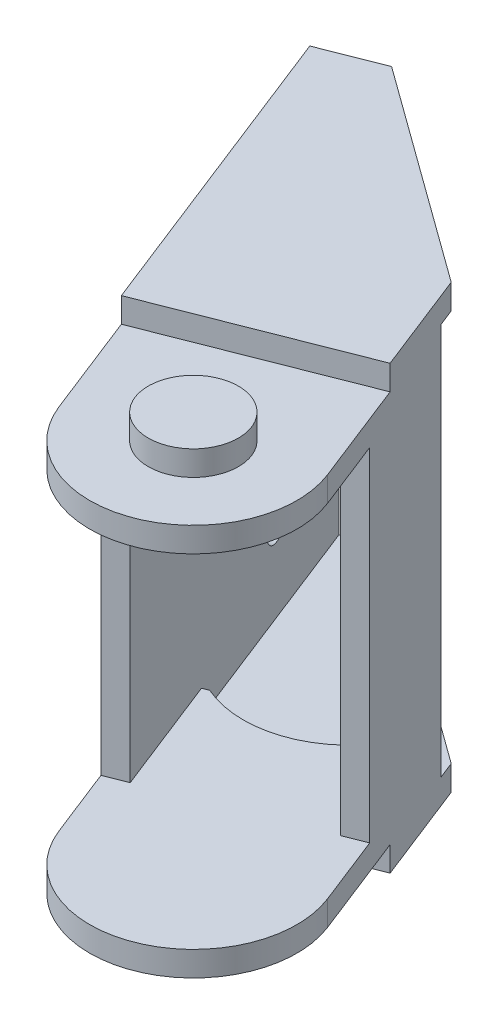
from build123d import *

# Parameters (mm, degrees)
SALIENTE_EXTRUIR1_START   = -2.75
SALIENTE_EXTRUIR1_DEPTH   = 5.5
SALIENTE_EXTRUIR1_2_DEPTH = 2.75
SALIENTE_EXTRUIR2_DEPTH   = 38
SALIENTE_EXTRUIR3_START   = 2.75
SALIENTE_EXTRUIR3_DEPTH   = 2.75
CROQUIS4_W                = 23
CROQUIS4_H                = 43.5
CORTAR_EXTRUIR1_DEPTH     = 8.25
CORTAR_EXTRUIR2_DEPTH     = 2.75
CROQUIS6_W                = 38
CROQUIS6_H                = 22.249999999
CORTAR_EXTRUIR3_DEPTH     = 16.59246817
CROQUIS7_W                = 3.203765914
CROQUIS7_H                = 38
CORTAR_EXTRUIR4_DEPTH     = 8.25
CROQUIS8_W                = 3.203765916
CROQUIS8_H                = 38
CORTAR_EXTRUIR5_DEPTH     = 8.25
CROQUIS9_W                = 14
CROQUIS9_H                = 38
CORTAR_EXTRUIR6_DEPTH     = 0.703765915
CROQUIS10_W               = 14
CROQUIS10_H               = 38
CORTAR_EXTRUIR7_DEPTH     = 0.703765915
SALIENTE_EXTRUIR4_START   = 2.75
SALIENTE_EXTRUIR4_DEPTH   = 2.75
CORTAR_EXTRUIR8_DEPTH     = 2.75
CROQUIS13_W               = 12.249999999
CROQUIS13_H               = 2.75
CORTAR_EXTRUIR9_DEPTH     = 74.034358614
CROQUIS14_W               = 12.249999999
CROQUIS14_H               = 2.75
CORTAR_EXTRUIR10_DEPTH    = 74.034358614
CROQUIS15_W               = 5
CROQUIS15_H               = 2.75
CROQUIS16_W               = 5
CROQUIS16_H               = 2.75
TALADRO1_D                = 10.15
TALADRO1_DEPTH            = 2.75
TALADRO2_D                = 10.15
CORTAR_EXTRUIR11_DEPTH    = 2.75
CORTAR_EXTRUIR12_START    = -2.75
CORTAR_EXTRUIR12_DEPTH    = 2.75
CORTAR_EXTRUIR13_REACH    = 202.135
SALIENTE_EXTRUIR5_DEPTH   = 2.75
SALIENTE_EXTRUIR6_DEPTH   = 2.75
CROQUIS26_W               = 27
CROQUIS26_H               = 43.5
SALIENTE_EXTRUIR7_DEPTH   = 2.5
CROQUIS27_R               = 2
CORTAR_EXTRUIR14_DEPTH    = 2.5


with BuildPart() as part:
    # Saliente-Extruir1: read off the stored shape, not the designer's step
    # Saliente-Extruir1 outline → Saliente-Extruir1 (new body)
    with BuildSketch(Plane(origin=(0, 40.75, 0), x_dir=(-1, 0, 0), z_dir=(0, 1, 0)).offset(SALIENTE_EXTRUIR1_START)):
        with BuildLine():
            Line((161.177139208, 19.345694485), (182.584423689, 27.755698719))
            Line((182.584423689, 27.755698719), (171.432026769, 56.143619441))
            ThreePointArc((171.432026769, 56.143619441), (156.523382412, 62.642259564), (150.024742289, 47.733615207))
            Line((150.024742289, 47.733615207), (161.177139208, 19.345694485))
        make_face()
    extrude(amount=SALIENTE_EXTRUIR1_DEPTH)

    # Saliente-Extruir1 2 outline → Saliente-Extruir1 2 (add)
    with BuildSketch(Plane(origin=(0, 40.75, 0), x_dir=(-1, 0, 0), z_dir=(0, 1, 0))):
        with BuildLine():
            ThreePointArc((161.177139208, 19.345694485), (176.085783565, 12.847054362), (182.584423687, 27.755698719))
            Line((182.584423687, 27.755698719), (161.177139208, 19.345694485))
        make_face()
    extrude(amount=SALIENTE_EXTRUIR1_2_DEPTH)

    # Croquis2 → Saliente-Extruir2 (add)
    with BuildSketch(Plane.XZ.offset(-38)):
        Polygon((-171.432026768, 56.143619442), (-150.024742288, 47.733615205), (-161.177139209, 19.345694483), (-182.584423689, 27.755698719), align=None)
    extrude(amount=SALIENTE_EXTRUIR2_DEPTH)

    # Croquis3 → Saliente-Extruir3 (add)
    with BuildSketch(Plane.XZ.offset(SALIENTE_EXTRUIR3_START)):
        with BuildLine():
            Line((-182.584423688, 27.755698719), (-171.432026768, 56.143619441))
            ThreePointArc((-171.432026768, 56.143619441), (-156.523382412, 62.642259564), (-150.024742289, 47.733615207))
            Line((-150.024742289, 47.733615207), (-161.177139208, 19.345694485))
            Line((-161.177139208, 19.345694485), (-182.584423688, 27.755698719))
        make_face()
    extrude(amount=-SALIENTE_EXTRUIR3_DEPTH)

    # Croquis4 → Cortar-Extruir1 (cut)
    with BuildSketch(Plane(origin=(-14.965700114, 0, -38.094511116), x_dir=(-0.9307514991056489, 0, 0.3656523580022251), z_dir=(-0.3656523580022251, 0, -0.9307514991056489))):
        with Locations((168.589662745, 19)):
            Rectangle(CROQUIS4_W, CROQUIS4_H)
    extrude(amount=-CORTAR_EXTRUIR1_DEPTH, mode=Mode.SUBTRACT)

    # Croquis5 → Cortar-Extruir2 (cut)
    with BuildSketch(Plane(origin=(0, 40.75, 0), x_dir=(1, 0, 0), z_dir=(0, 1, 0))):
        with BuildLine():
            Line((-161.142417183, -28.195858914), (-176.585881806, -34.262934025))
            ThreePointArc((-176.585881806, -34.262934025), (-167.602648859, -34.440489141), (-161.142417183, -28.195858914))
        make_face()
    extrude(amount=-CORTAR_EXTRUIR2_DEPTH, mode=Mode.SUBTRACT)

    # Croquis6 → Cortar-Extruir3 (cut)
    with BuildSketch(Plane(origin=(-149.193349022, 0, 58.611670162), x_dir=(0, 1, 0), z_dir=(0.9307514991056486, 0, -0.3656523580022258))):
        with Locations((19, -21.553766865)):
            Rectangle(CROQUIS6_W, CROQUIS6_H)
    extrude(amount=-CORTAR_EXTRUIR3_DEPTH, mode=Mode.SUBTRACT)

    # Croquis7 → Cortar-Extruir4 (cut)
    with BuildSketch(Plane(origin=(-3.8133032, 0, -9.706590403), x_dir=(0.9307514990825102, 0, -0.36565235806112356), z_dir=(0.36565235806112356, 0, 0.9307514990825102))):
        with Locations((-158.691545702, 19)):
            Rectangle(CROQUIS7_W, CROQUIS7_H)
    extrude(amount=-CORTAR_EXTRUIR4_DEPTH, mode=Mode.SUBTRACT)

    # Croquis8 → Cortar-Extruir5 (cut)
    with BuildSketch(Plane(origin=(-3.8133032, 0, -9.706590403), x_dir=(0.9307514990825102, 0, -0.36565235806112356), z_dir=(0.36565235806112356, 0, 0.9307514990825102))):
        with Locations((-178.487779787, 19)):
            Rectangle(CROQUIS8_W, CROQUIS8_H)
    extrude(amount=-CORTAR_EXTRUIR5_DEPTH, mode=Mode.SUBTRACT)

    # Croquis9 → Cortar-Extruir6 (cut)
    with BuildSketch(Plane(origin=(-164.636813645, 0, 64.678745273), x_dir=(-0.3656523580022247, 0, -0.930751499105649), z_dir=(0.930751499105649, 1.4355340193330324e-15, -0.3656523580022247))):
        with Locations((25.678766864, 19)):
            Rectangle(CROQUIS9_W, CROQUIS9_H)
    extrude(amount=-CORTAR_EXTRUIR6_DEPTH, mode=Mode.SUBTRACT)

    # Croquis10 → Cortar-Extruir7 (cut)
    with BuildSketch(Plane(origin=(-149.193349022, 0, 58.611670162), x_dir=(0.3656523580022248, 0, 0.930751499105649), z_dir=(-0.930751499105649, -1.4355340193330322e-15, 0.3656523580022248))):
        with Locations((-25.678766864, 19)):
            Rectangle(CROQUIS10_W, CROQUIS10_H)
    extrude(amount=-CORTAR_EXTRUIR7_DEPTH, mode=Mode.SUBTRACT)

    # Croquis11 → Saliente-Extruir4 (add)
    with BuildSketch(Plane.XZ.offset(2.75).offset(SALIENTE_EXTRUIR4_START)):
        with BuildLine():
            Line((-150.024742289, 47.733615207), (-161.177139208, 19.345694485))
            ThreePointArc((-161.177139208, 19.345694485), (-176.085783565, 12.847054362), (-182.584423687, 27.755698719))
            Line((-182.584423687, 27.755698719), (-171.432026769, 56.143619441))
            ThreePointArc((-171.432026769, 56.143619441), (-156.523382412, 62.642259564), (-150.024742289, 47.733615207))
        make_face()
    extrude(amount=-SALIENTE_EXTRUIR4_DEPTH)

    # Croquis12 → Cortar-Extruir8 (cut)
    with BuildSketch(Plane(origin=(0, 0, 0), x_dir=(-1, 0, 0), z_dir=(0, 1, 0))):
        with BuildLine():
            Line((161.142417183, 28.195858914), (176.585881806, 34.262934025))
            ThreePointArc((176.585881806, 34.262934025), (167.602648859, 34.440489141), (161.142417183, 28.195858914))
        make_face()
    extrude(amount=-CORTAR_EXTRUIR8_DEPTH, mode=Mode.SUBTRACT)

    # Croquis13 → Cortar-Extruir9 (cut, through all)
    with BuildSketch(Plane(origin=(-146.211439094, 0, 57.440205601), x_dir=(-0.36565235800222584, 0, -0.9307514991056486), z_dir=(0.9307514991056486, 0, -0.36565235800222584))):
        with Locations((16.553766864, -4.125)):
            Rectangle(CROQUIS13_W, CROQUIS13_H)
    extrude(amount=-CORTAR_EXTRUIR9_DEPTH, mode=Mode.SUBTRACT)

    # Croquis14 → Cortar-Extruir10 (cut, through all)
    with BuildSketch(Plane(origin=(-146.211439094, 0, 57.440205601), x_dir=(-0.36565235800222584, 0, -0.9307514991056486), z_dir=(0.9307514991056486, 0, -0.36565235800222584))):
        with Locations((16.553766864, 42.125)):
            Rectangle(CROQUIS14_W, CROQUIS14_H)
    extrude(amount=-CORTAR_EXTRUIR10_DEPTH, mode=Mode.SUBTRACT)

    # Croquis15 → Revolución1 (revolve)
    with BuildSketch(Plane(origin=(0, 0, 51.938617325), x_dir=(-1, 0, 0), z_dir=(0, 0, -1))):
        with Locations((158.228384529, -4.125)):
            Rectangle(CROQUIS15_W, CROQUIS15_H)
    revolve(axis=Axis((-160.728384529, -5.5, 51.938617325), (0, 1, 0)))

    # Croquis16 → Revolución2 (revolve)
    with BuildSketch(Plane(origin=(0, 0, 51.938617325), x_dir=(-1, 0, 0), z_dir=(0, 0, -1))):
        with Locations((158.228384529, 42.125)):
            Rectangle(CROQUIS16_W, CROQUIS16_H)
    revolve(axis=Axis((-160.728384529, 40.75, 51.938617325), (0, 1, 0)))

    # Taladro1
    with Locations(Plane(origin=(0, -5.5, 0), x_dir=(-1, 0, 0), z_dir=(0, -1, 0))):
        with Locations((171.880781448, -23.550696602)):
            Hole(TALADRO1_D / 2, depth=TALADRO1_DEPTH)

    # Taladro2 (through all)
    with Locations(Plane(origin=(0, 40.75, 0), x_dir=(-1, 0, 0), z_dir=(0, -1, 0))):
        with Locations((171.880781448, -23.550696602)):
            Hole(TALADRO2_D / 2)

    # Croquis21 → Cortar-Extruir11 (cut)
    with BuildSketch(Plane.XZ.offset(5.5)):
        with BuildLine():
            ThreePointArc((-165.382142024, 53.766879114), (-158.900122739, 56.59237482), (-156.074627033, 50.110355534))
            Line((-156.074627033, 50.110355534), (-150.024742289, 47.733615207))
            ThreePointArc((-150.024742289, 47.733615207), (-156.523382412, 62.642259564), (-171.432026769, 56.143619441))
            Line((-171.432026769, 56.143619441), (-165.382142024, 53.766879114))
        make_face()
    extrude(amount=-CORTAR_EXTRUIR11_DEPTH, mode=Mode.SUBTRACT)

    # Croquis22 → Cortar-Extruir12 (cut)
    with BuildSketch(Plane(origin=(0, 43.5, 0), x_dir=(1, 0, 0), z_dir=(0, 1, 0)).offset(CORTAR_EXTRUIR12_START)):
        with BuildLine():
            ThreePointArc((-165.382142024, -53.766879115), (-158.900122739, -56.59237482), (-156.074627033, -50.110355534))
            Line((-156.074627033, -50.110355534), (-150.024742289, -47.733615207))
            ThreePointArc((-150.024742289, -47.733615207), (-156.523382412, -62.642259564), (-171.432026769, -56.143619442))
            Line((-171.432026769, -56.143619442), (-165.382142024, -53.766879115))
        make_face()
    extrude(amount=CORTAR_EXTRUIR12_DEPTH, mode=Mode.SUBTRACT)

    # Cortar-Extruir13: up to this face of the body (flat: up to its plane)
    cortar_extruir13_end = Plane(part.part.faces().sort_by_distance((-169.996704911, 43.5, 28.346528005))[0])
    # Croquis23 → Cortar-Extruir13 (cut, up to the picked face)
    with BuildSketch(Plane.XZ.offset(5.5), mode=Mode.PRIVATE) as cortar_extruir13_sk1:
        Polygon((-180.29909645, 33.572895588), (-158.891811971, 25.162891354), (-166.204859131, 6.547861372), (-187.61214361, 14.957865606), align=None)
    cortar_extruir13_tool1 = split(extrude(cortar_extruir13_sk1.sketch, amount=-CORTAR_EXTRUIR13_REACH, mode=Mode.PRIVATE), bisect_by=cortar_extruir13_end, keep=Keep.BOTH, mode=Mode.PRIVATE)
    add(cortar_extruir13_tool1.solids().sort_by(Axis((-173.251978, -5.5, 20.060378), (0, 1, 0)))[0], mode=Mode.SUBTRACT)

    # Croquis24 → Saliente-Extruir5 (add)
    with BuildSketch(Plane.XZ.offset(5.5)):
        Polygon((-180.29909645, 33.572895588), (-189.4404054, 10.304108111), (-182.925144906, 7.744541605), (-158.891811971, 25.162891354), align=None)
    extrude(amount=-SALIENTE_EXTRUIR5_DEPTH)

    # Croquis25 → Saliente-Extruir6 (add)
    with BuildSketch(Plane(origin=(0, 43.5, 0), x_dir=(1, 0, 0), z_dir=(0, 1, 0))):
        Polygon((-180.29909645, -33.572895588), (-189.4404054, -10.304108111), (-182.925144906, -7.744541605), (-158.891811971, -25.162891354), align=None)
    extrude(amount=-SALIENTE_EXTRUIR6_DEPTH)

    # Croquis26 → Saliente-Extruir7 (add)
    with BuildSketch(Plane(origin=(-167.618723573, 0, 65.850209835), x_dir=(0.36565235800222584, 0, 0.9307514991056486), z_dir=(-0.9307514991056486, 0, 0.36565235800222584))):
        with Locations((-46.178766864, 19)):
            Rectangle(CROQUIS26_W, CROQUIS26_H)
    extrude(amount=-SALIENTE_EXTRUIR7_DEPTH)

    # Croquis27 → Cortar-Extruir14 (cut)
    with BuildSketch(Plane(origin=(-167.618723573, 0, 65.850209835), x_dir=(0.36565235800222584, 0, 0.9307514991056486), z_dir=(-0.9307514991056486, 0, 0.36565235800222584))):
        with Locations((-47.428766864, 31.5)):
            Circle(CROQUIS27_R)
        with Locations((-47.428766864, 6.5)):
            Circle(CROQUIS27_R)
        with Locations((-34.928766864, 19)):
            Circle(CROQUIS27_R)
    extrude(amount=-CORTAR_EXTRUIR14_DEPTH, mode=Mode.SUBTRACT)


solid = part.part
